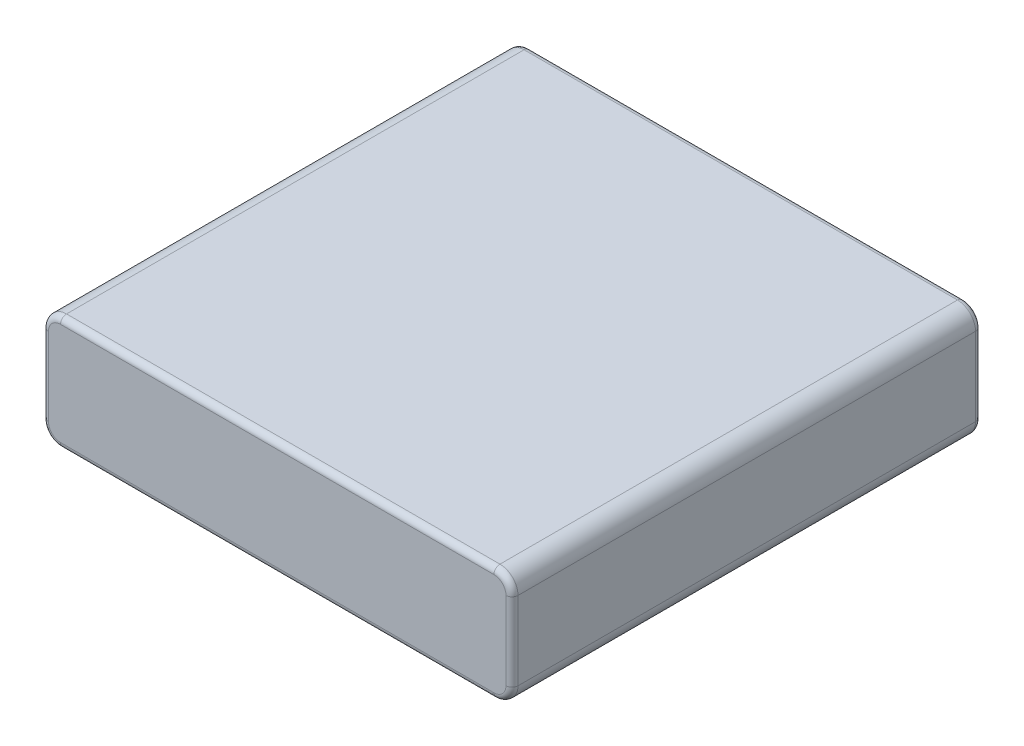
from build123d import *

# Parameters (mm, degrees)
SKETCH1_W           = 78
SKETCH1_H           = 78
BOSS_EXTRUDE1_DEPTH = 9.5
SKETCH2_R           = 1.75
CUT_EXTRUDE1_DEPTH  = 19
SKETCH3_W           = 6
SKETCH3_H           = 4
CUT_EXTRUDE2_DEPTH  = 5
FILLET2_R           = 1
FILLET3_R           = 3
FILLET4_R           = 1


with BuildPart() as part:
    # Sketch1 → Boss-Extrude1 (new, symmetric)
    with BuildSketch(Plane(origin=(0, 0, 0), x_dir=(1, 0, 0), z_dir=(0, 1, 0))):
        Rectangle(SKETCH1_W, SKETCH1_H)
    extrude(amount=BOSS_EXTRUDE1_DEPTH, both=True)

    # Sketch2 → Cut-Extrude1 (cut)
    with BuildSketch(Plane(origin=(0, 0, -39), x_dir=(-1, 0, 0), z_dir=(0, 0, -1))):
        with Locations((-33, -2.5)):
            Circle(SKETCH2_R)
    extrude(amount=-CUT_EXTRUDE1_DEPTH, mode=Mode.SUBTRACT)

    # Sketch3 → Cut-Extrude2 (cut)
    with BuildSketch(Plane.XZ.offset(9.5)):
        with Locations((-27.1, -33)):
            Rectangle(SKETCH3_W, SKETCH3_H)
    extrude(amount=-CUT_EXTRUDE2_DEPTH, mode=Mode.SUBTRACT)

    # Fillet2
    fillet2_edges = [part.edges().sort_by_distance(p)[0] for p in [
        (0, -9.5, -39),
        (-39, 0, -39),
        (39, 0, -39),
        (0, 9.5, -39),
    ]]
    fillet(fillet2_edges, radius=FILLET2_R)

    # Fillet3
    # the kernel refuses this fillet: 3 mm, written as the material it takes off along each edge
    with BuildSketch(Plane(origin=(36, 6.5, -39), x_dir=(0, 1, 0), z_dir=(-1, 0, 0))) as fillet3_piece_1:
        with BuildLine():
            CenterArc((2, -1), 1, 0, 90)
            Line((3, -1), (3, 0))
            Line((3, 0), (2, 0))
        make_face()
    revolve(axis=Axis((36, 6.5, -39), (0, 0, -1)), revolution_arc=90, mode=Mode.SUBTRACT)
    with BuildSketch(Plane(origin=(36, -6.5, -39), x_dir=(1, 0, 0), z_dir=(0, 1, 0))) as fillet3_piece_2:
        with BuildLine():
            CenterArc((2, -1), 1, 0, 90)
            Line((3, -1), (3, 0))
            Line((3, 0), (2, 0))
        make_face()
    revolve(axis=Axis((36, -6.5, -39), (0, 0, -1)), revolution_arc=90, mode=Mode.SUBTRACT)
    with BuildSketch(Plane(origin=(-36, 6.5, -39), x_dir=(-1, 0, 0), z_dir=(0, -1, 0))) as fillet3_piece_3:
        with BuildLine():
            CenterArc((2, -1), 1, 0, 90)
            Line((3, -1), (3, 0))
            Line((3, 0), (2, 0))
        make_face()
    revolve(axis=Axis((-36, 6.5, -39), (0, 0, -1)), revolution_arc=90, mode=Mode.SUBTRACT)
    with BuildSketch(Plane(origin=(-36, -6.5, -39), x_dir=(0, -1, 0), z_dir=(1, 0, 0))) as fillet3_piece_4:
        with BuildLine():
            CenterArc((2, -1), 1, 0, 90)
            Line((3, -1), (3, 0))
            Line((3, 0), (2, 0))
        make_face()
    revolve(axis=Axis((-36, -6.5, -39), (0, 0, -1)), revolution_arc=90, mode=Mode.SUBTRACT)
    with BuildSketch(Plane(origin=(-39, -9.5, 46.5), x_dir=(1, 0, 0), z_dir=(0, 0, -1)), Plane(origin=(-39, 9.5, 46.5), x_dir=(0, -1, 0), z_dir=(0, 0, -1)), Plane(origin=(39, 9.5, -39), x_dir=(0, -1, 0), z_dir=(0, 0, 1)), Plane(origin=(39, -9.5, -39), x_dir=(-1, 0, 0), z_dir=(0, 0, 1))) as fillet3_piece_5:
        with BuildLine():
            CenterArc((FILLET3_R, -FILLET3_R), FILLET3_R, 90, 90)
            Line((0, -FILLET3_R), (0, 0))
            Line((0, 0), (FILLET3_R, 0))
        make_face()
    extrude(amount=85.5, mode=Mode.SUBTRACT)

    # Fillet4
    fillet4_edges = [part.edges().sort_by_distance(p)[0] for p in [
        (0, 9.5, 39),
        (0, -9.5, 39),
        (39, 0, 39),
        (-39, 0, 39),
        (38.121320344, -8.621320344, 39),
        (38.121320344, 8.621320344, 39),
        (-38.121320344, -8.621320344, 39),
        (-38.121320344, 8.621320344, 39),
    ]]
    fillet(fillet4_edges, radius=FILLET4_R)


solid = part.part
